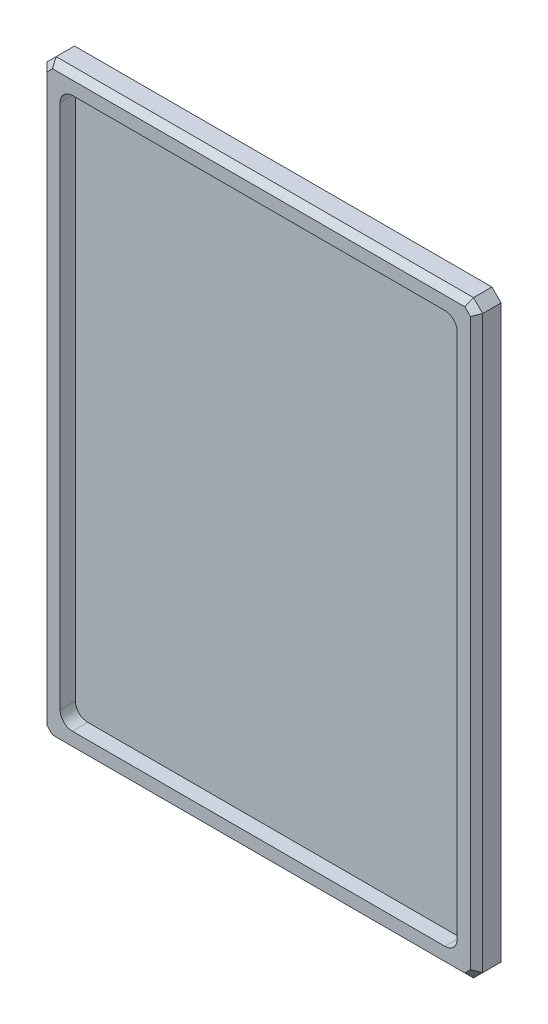
from build123d import *

# Parameters (mm, degrees)
SKETCH1_W           = 225.425
SKETCH1_H           = 304.8
BOSS_EXTRUDE1_DEPTH = 12.7
CUT_EXTRUDE1_DEPTH  = 7.9375
CHAMFER2_SIZE       = 4.7625
CHAMFER1_SIZE       = 3.175


with BuildPart() as part:
    # Sketch1 → Boss-Extrude1 (new body)
    with BuildSketch(Plane.XY):
        Rectangle(SKETCH1_W, SKETCH1_H)
    extrude(amount=BOSS_EXTRUDE1_DEPTH)

    # Sketch2 → Cut-Extrude1 (cut)
    with BuildSketch(Plane.XY.offset(12.7)):
        with BuildLine():
            Line((96.3625, -142.4), (-96.3625, -142.4))
            ThreePointArc((-96.3625, -142.4), (-100.852628061, -140.540128061), (-102.7125, -136.05))
            Line((-102.7125, -136.05), (-102.7125, 136.05))
            ThreePointArc((-102.7125, 136.05), (-100.852628061, 140.540128061), (-96.3625, 142.4))
            Line((-96.3625, 142.4), (96.3625, 142.4))
            ThreePointArc((96.3625, 142.4), (100.852628061, 140.540128061), (102.7125, 136.05))
            Line((102.7125, 136.05), (102.7125, -136.05))
            ThreePointArc((102.7125, -136.05), (100.852628061, -140.540128061), (96.3625, -142.4))
        make_face()
    extrude(amount=-CUT_EXTRUDE1_DEPTH, mode=Mode.SUBTRACT)

    # Chamfer2
    chamfer2_edges = [part.edges().sort_by_distance(p)[0] for p in [
        (-112.7125, -152.4, 6.35),
        (-112.7125, 152.4, 6.35),
        (112.7125, -152.4, 6.35),
        (112.7125, 152.4, 6.35),
    ]]
    chamfer(chamfer2_edges, length=CHAMFER2_SIZE)

    # Chamfer1
    chamfer1_edges = [part.edges().sort_by_distance(p)[0] for p in [
        (0, -152.4, 12.7),
        (-112.7125, 0, 12.7),
        (112.7125, 0, 12.7),
        (0, 152.4, 12.7),
        (-110.33125, -150.01875, 12.7),
        (110.33125, -150.01875, 12.7),
        (-110.33125, 150.01875, 12.7),
        (110.33125, 150.01875, 12.7),
    ]]
    chamfer(chamfer1_edges, length=CHAMFER1_SIZE)


solid = part.part
